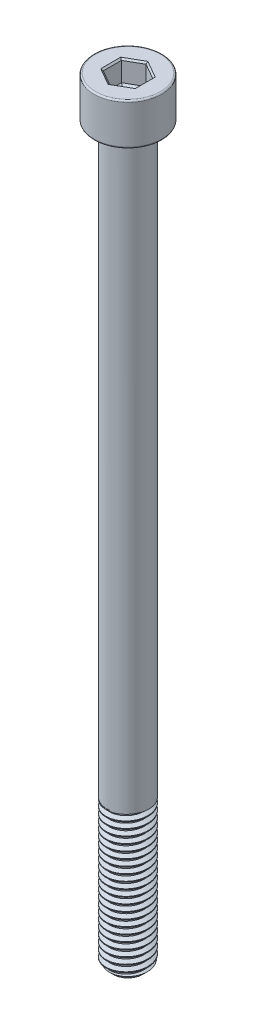
from build123d import *

# Parameters (mm, degrees)
SKETCH1_R           = 4
BOSS_EXTRUDE1_DEPTH = 28
THREAD1_PITCH       = 1.25
SKETCH2_R           = 4
BOSS_EXTRUDE2_DEPTH = 112
SKETCH5_R           = 6.5
BOSS_EXTRUDE3_DEPTH = 8
FILLET1_R           = 0.3
CUT_EXTRUDE1_DEPTH  = 4
CHAMFER1_SIZE       = 0.3
CUT_EXTRUDE2_DEPTH  = 0.4
CUT_EXTRUDE2_DRAFT  = -60


with BuildPart() as part:
    # Sketch1 → Boss-Extrude1 (new body)
    with BuildSketch(Plane(origin=(0, 0, 0), x_dir=(1, 0, 0), z_dir=(0, 1, 0))):
        with Locations(Location((0, 0, 0), (0, 0, 270))):
            Circle(SKETCH1_R)
    extrude(amount=BOSS_EXTRUDE1_DEPTH)

    # Thread1: the profile of Thread Profile1 profile screwed along a right-hand helix of 24 turns, 8 arcs to a turn; built about Z, then put on its axis
    thread1_z = Axis((0, 0, 0), (0, 0, 1))
    thread1_corners = [(4.0003, 0, -0.000173205), (4.0003, 0, 1.093923202), (3.323417656, 0, 0.703124998), (3.323417656, 0, 0.390624998)]
    with BuildLine(mode=Mode.PRIVATE) as thread1_profile:
        Line(thread1_corners[0], thread1_corners[1])
        Line(thread1_corners[1], thread1_corners[2])
        Line(thread1_corners[2], thread1_corners[3])
        Line(thread1_corners[3], thread1_corners[0])
    thread1_cap = Face(thread1_profile.wire())
    thread1_turn_angles = [0, 22.5, 45, 67.5, 90, 112.5, 135, 157.5, 180, 202.5, 225, 247.5, 270, 292.5, 315, 337.5, 360]
    thread1_turn_weights = [1, 0.9238795325112867, 1, 0.9238795325112867, 1, 0.9238795325112867, 1, 0.9238795325112867, 1, 0.9238795325112867, 1, 0.9238795325112867, 1, 0.9238795325112867, 1, 0.9238795325112867, 1]
    thread1_turn_rails = [Edge.make_bspline([Vector(p[0], p[1], 0).rotate(thread1_z, thread1_turn_angles[k]) / thread1_turn_weights[k] + Vector(0, 0, p[2] + THREAD1_PITCH * thread1_turn_angles[k] / 360) for k in range(17)], [0, 0, 0, 1, 1, 2, 2, 3, 3, 4, 4, 5, 5, 6, 6, 7, 7, 8, 8, 8], 2, thread1_turn_weights) for p in thread1_corners]
    thread1_turn_sides = [Face.make_surface_from_curves(thread1_turn_rails[p[0]], thread1_turn_rails[p[1]]) for p in [(0, 1), (1, 2), (2, 3), (3, 0)]]
    thread1 = Plane(origin=(0, 30, 0), x_dir=(-1, 0, 0), z_dir=(0, -1, 0)) * Solid(Shell([*[p.moved(Location((0, 0, THREAD1_PITCH * i))) for i in range(24) for p in thread1_turn_sides], thread1_cap, thread1_cap.rotate(thread1_z, 8640).moved(Location((0, 0, THREAD1_PITCH * 8640 / 360)))]))
    add(thread1, mode=Mode.SUBTRACT)

    # Sketch2 → Boss-Extrude2 (add)
    with BuildSketch(Plane(origin=(0, 28, 0), x_dir=(1, 0, 0), z_dir=(0, 1, 0))):
        with Locations(Location((0, 0, 0), (0, 0, 117.593571361))):
            Circle(SKETCH2_R)
    extrude(amount=BOSS_EXTRUDE2_DEPTH)

    # Sketch5 → Boss-Extrude3 (add)
    with BuildSketch(Plane(origin=(0, 140, 0), x_dir=(1, 0, 0), z_dir=(0, 1, 0))):
        with Locations(Location((0, 0, 0), (0, 0, 270))):
            Circle(SKETCH5_R)
    extrude(amount=BOSS_EXTRUDE3_DEPTH)

    # Sketch6 → Cut-Revolve1 (revolve, cut)
    with BuildSketch(Plane.XY, mode=Mode.PRIVATE) as cut_revolve1_sk:
        Polygon((4.01, 0), (4.01, 1.2), (2.81, 0), align=None)
    revolve(cut_revolve1_sk.sketch.rotate(Axis((0, 0, 0), (0, 1, 0)), 117.593571361), axis=Axis((0, 0, 0), (0, 1, 0)), mode=Mode.SUBTRACT)

    # Fillet1
    fillet1_edges = [part.edges().sort_by_distance(p)[0] for p in [
        (0, 140, -6.5),
        (0, 148, -6.5),
    ]]
    fillet(fillet1_edges, radius=FILLET1_R)

    # Sketch7 → Cut-Extrude1 (cut)
    with BuildSketch(Plane(origin=(0, 148, 0), x_dir=(1, 0, 0), z_dir=(0, 1, 0))):
        Polygon((0, 3.464101615), (-3, 1.732050808), (-3, -1.732050808), (0, -3.464101615), (3, -1.732050808), (3, 1.732050808), align=None)
    extrude(amount=-CUT_EXTRUDE1_DEPTH, mode=Mode.SUBTRACT)

    # Chamfer1
    chamfer1_edges = [part.edges().sort_by_distance(p)[0] for p in [
        (1.5, 148, -2.598076211),
        (-1.5, 148, -2.598076211),
        (-3, 148, 0),
        (-1.5, 148, 2.598076211),
        (1.5, 148, 2.598076211),
        (3, 148, 0),
    ]]
    chamfer(chamfer1_edges, length=CHAMFER1_SIZE)


with BuildPart() as cut_extrude2_tool:
    # Sketch8 → Cut-Extrude2 (with draft: the straight prism first)
    with BuildSketch(Plane(origin=(0, 144, 0), x_dir=(1, 0, 0), z_dir=(0, 1, 0))):
        Polygon((0, 3.464101615), (-3, 1.732050808), (-3, -1.732050808), (0, -3.464101615), (3, -1.732050808), (3, 1.732050808), align=None)
    extrude(amount=-CUT_EXTRUDE2_DEPTH)
    # Cut-Extrude2: the draft: its side faces are tilted about the plane it starts from
    cut_extrude2_sides = [cut_extrude2_tool.faces().sort_by_distance(p)[0] for p in [
        (-1.5, 143.8, -2.598076211),
        (-3, 143.8, 0),
        (-1.5, 143.8, 2.598076211),
        (1.5, 143.8, 2.598076211),
        (3, 143.8, 0),
        (1.5, 143.8, -2.598076211),
    ]]
    draft(cut_extrude2_sides, Plane(origin=(0, 144, 0), x_dir=(1, 0, 0), z_dir=(0, 1, 0)), CUT_EXTRUDE2_DRAFT)


with BuildPart() as part_1:
    add(part.part)

    # Cut-Extrude2: cut by cut_extrude2_tool
    add(cut_extrude2_tool.part, mode=Mode.SUBTRACT)


solid = part_1.part
